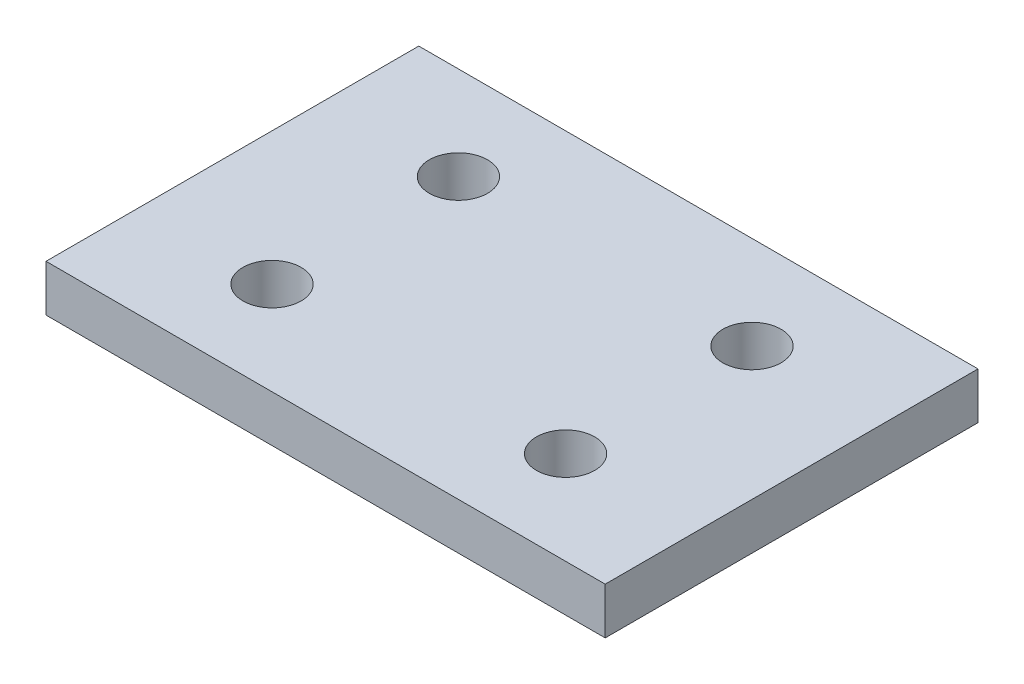
from build123d import *

# Parameters (mm, degrees)
SKETCH1_W           = 76.2
SKETCH1_H           = 50.8
BOSS_EXTRUDE1_DEPTH = 6.35
SKETCH3_R           = 3.96875
CUT_EXTRUDE1_DEPTH  = 92.800885072


with BuildPart() as part:
    # Sketch1 → Boss-Extrude1 (new body)
    with BuildSketch(Plane(origin=(0, 0, 0), x_dir=(1, 0, 0), z_dir=(0, 1, 0))):
        with Locations((38.1, 25.4)):
            Rectangle(SKETCH1_W, SKETCH1_H)
    extrude(amount=BOSS_EXTRUDE1_DEPTH)

    # Sketch3 → Cut-Extrude1 (cut, through all)
    with BuildSketch(Plane(origin=(0, 6.35, 0), x_dir=(1, 0, 0), z_dir=(0, 1, 0))):
        with Locations((18.1, 38.1)):
            Circle(SKETCH3_R)
        with Locations((18.1, 12.7)):
            Circle(SKETCH3_R)
        with Locations((58.1, 38.1)):
            Circle(SKETCH3_R)
        with Locations((58.1, 12.7)):
            Circle(SKETCH3_R)
    extrude(amount=-CUT_EXTRUDE1_DEPTH, mode=Mode.SUBTRACT)


solid = part.part
